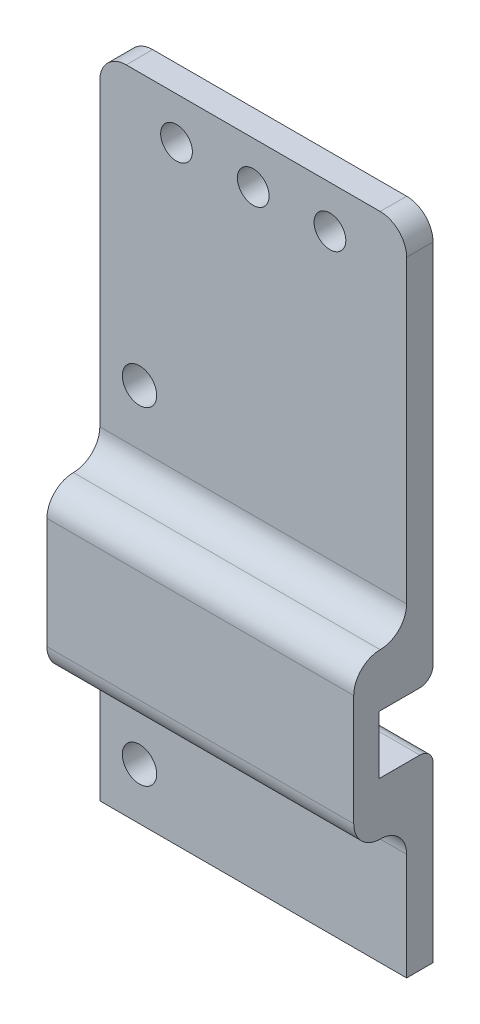
from build123d import *

# Parameters (mm, degrees)
SKETCH1_W           = 58
SKETCH1_H           = 20
BOSS_EXTRUDE1_DEPTH = 10
SKETCH2_W           = 58
SKETCH2_H           = 10
BOSS_EXTRUDE3_DEPTH = 103
SKETCH4_W           = 58
SKETCH4_H           = 11
CUT_EXTRUDE2_DEPTH  = 103
SKETCH5_W           = 58
SKETCH5_H           = 31
BOSS_EXTRUDE4_DEPTH = 5
SKETCH6_W           = 58
SKETCH6_H           = 66.819677738
SKETCH6_W_2         = 58.198762754
SKETCH6_H_2         = 25.25
CUT_EXTRUDE3_DEPTH  = 5
FILLET2_START       = -39
FILLET2_DEPTH       = 58
FILLET2_2_DEPTH     = 58
FILLET3_R           = 2.5
SKETCH7_W           = 58.063983185
SKETCH7_H           = 11
CUT_EXTRUDE4_DEPTH  = 0.25
SKETCH9_R           = 3
SKETCH9_R_2         = 3.25
CUT_EXTRUDE5_DEPTH  = 139.455769111
FILLET4_R           = 5


with BuildPart() as part:
    # Sketch1 → Boss-Extrude1 (new body)
    with BuildSketch(Plane.XY):
        with Locations((-10, -19)):
            Rectangle(SKETCH1_W, SKETCH1_H)
    extrude(amount=BOSS_EXTRUDE1_DEPTH)

    # Sketch2 → Boss-Extrude3 (add)
    with BuildSketch(Plane.XZ.offset(29)):
        with Locations((-10, 5)):
            Rectangle(SKETCH2_W, SKETCH2_H)
    extrude(amount=BOSS_EXTRUDE3_DEPTH)

    # Sketch4 → Cut-Extrude2 (cut)
    with BuildSketch(Plane.XY.offset(10)):
        with Locations((-10, -91.25)):
            Rectangle(SKETCH4_W, SKETCH4_H)
    extrude(amount=-CUT_EXTRUDE2_DEPTH, mode=Mode.SUBTRACT)


with BuildPart() as cut_extrude2_piece_1:
    # of the separate pieces the step leaves, piece 1, a body of its own (cut_extrude2_pieces)
    add(part.part.solids().sort_by_distance((-39, -9, 0))[0])



with BuildPart() as cut_extrude2_piece_2:
    # of the separate pieces the step leaves, piece 2, a body of its own (cut_extrude2_pieces)
    add(part.part.solids().sort_by_distance((-39, -96.75, 10))[0])


with BuildPart() as cut_extrude2_piece_1_1:
    add(cut_extrude2_piece_1.part)

    add(cut_extrude2_piece_2.part)  # Boss-Extrude4 merges Cut-Extrude2 piece 2
    # Sketch5 → Boss-Extrude4 (add)
    with BuildSketch(Plane.XY.offset(10)):
        with Locations((-10, -91.25)):
            Rectangle(SKETCH5_W, SKETCH5_H)
    extrude(amount=BOSS_EXTRUDE4_DEPTH)

    # Sketch6 → Cut-Extrude3 (cut)
    with BuildSketch(Plane.XY.offset(10)):
        with Locations((-10, -42.340161131)):
            Rectangle(SKETCH6_W, SKETCH6_H)
        with Locations((-9.900618623, -119.375)):
            Rectangle(SKETCH6_W_2, SKETCH6_H_2)
    extrude(amount=-CUT_EXTRUDE3_DEPTH, mode=Mode.SUBTRACT)

    # Fillet2: read off the stored shape, not the designer's step
    # Fillet2 outline → Fillet2 (cut)
    with BuildSketch(Plane.YZ.offset(FILLET2_START)):
        with BuildLine():
            ThreePointArc((-106.75, 10), (-105.285533906, 13.535533906), (-101.75, 15))
            Line((-101.75, 15), (-106.75, 15))
            Line((-106.75, 15), (-106.75, 10))
        make_face()
        with BuildLine():
            ThreePointArc((-80.75, 15), (-77.214466094, 13.535533906), (-75.75, 10))
            Line((-75.75, 10), (-75.75, 15))
            Line((-75.75, 15), (-80.75, 15))
        make_face()
    extrude(amount=FILLET2_DEPTH, mode=Mode.SUBTRACT)

    # Fillet2 2 outline → Fillet2 2 (add)
    with BuildSketch(Plane.YZ.offset(FILLET2_START)):
        with BuildLine():
            Line((-75.75, 5), (-70.75, 5))
            ThreePointArc((-70.75, 5), (-74.285533906, 6.464466094), (-75.75, 10))
            Line((-75.75, 10), (-75.75, 5))
        make_face()
        with BuildLine():
            Line((-106.75, 5), (-106.75, 10))
            ThreePointArc((-106.75, 10), (-108.214466094, 6.464466094), (-111.75, 5))
            Line((-111.75, 5), (-106.75, 5))
        make_face()
    extrude(amount=FILLET2_2_DEPTH)

    # Fillet3
    fillet3_edges = [cut_extrude2_piece_1_1.edges().sort_by_distance(p)[0] for p in [
        (-10, -85.75, 0),
        (-10, -96.75, 0),
    ]]
    fillet(fillet3_edges, radius=FILLET3_R)

    # Sketch7 → Cut-Extrude4 (cut)
    with BuildSketch(Plane(origin=(0, 0, 10), x_dir=(-1, 0, 0), z_dir=(0, 0, -1))):
        with Locations((9.968008407, -91.25)):
            Rectangle(SKETCH7_W, SKETCH7_H)
    extrude(amount=-CUT_EXTRUDE4_DEPTH, mode=Mode.SUBTRACT)

    # Sketch9 → Cut-Extrude5 (cut, through all)
    with BuildSketch(Plane(origin=(0, 0, 0), x_dir=(-1, 0, 0), z_dir=(0, 0, -1))):
        with Locations((24.5, -17)):
            Circle(SKETCH9_R)
        with Locations((10, -17)):
            Circle(SKETCH9_R)
        with Locations((-4.5, -17)):
            Circle(SKETCH9_R)
        with Locations((31.5, -60.25)):
            Circle(SKETCH9_R_2)
        with Locations((31.5, -122.25)):
            Circle(SKETCH9_R_2)
    extrude(amount=-CUT_EXTRUDE5_DEPTH, mode=Mode.SUBTRACT)

    # Fillet4
    fillet4_edges = [cut_extrude2_piece_1_1.edges().sort_by_distance(p)[0] for p in [
        (-39, -9, 2.5),
        (19, -9, 2.5),
    ]]
    fillet(fillet4_edges, radius=FILLET4_R)


solid = cut_extrude2_piece_1_1.part
